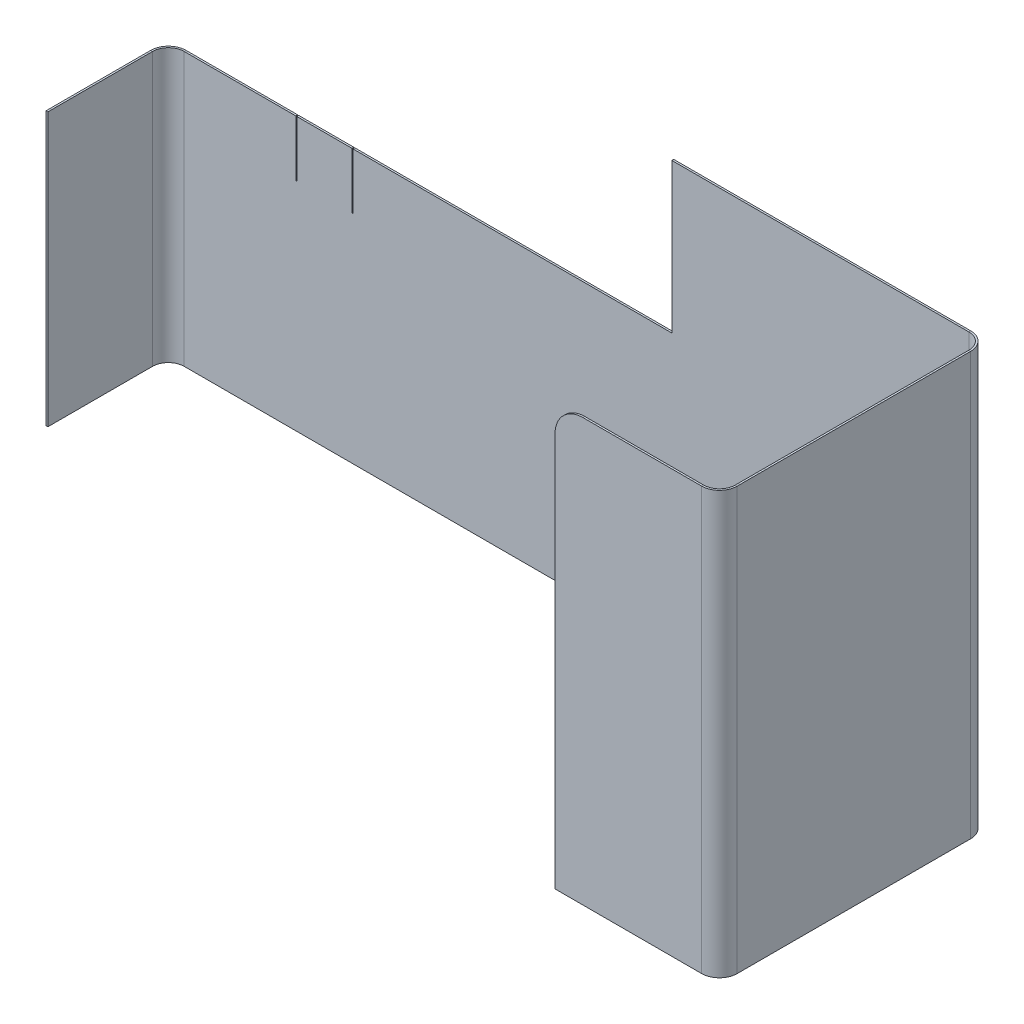
from build123d import *

# Parameters (mm, degrees)
T_LE_DE_BASE_PLI_E1_DEPTH = 226
CONG_1_R                  = 15
ESQUISSE2_W               = 270.5
ESQUISSE2_H               = 65.5
ENL_V_MAT_EXTRU_1_DEPTH   = 80
ESQUISSE6_W               = 0.5
ESQUISSE6_H               = 30
ENL_V_MAT_EXTRU_2_DEPTH   = 10


# Read off the part's stored shape, not the designer's step: Tôle de base pliée1
with BuildPart() as part:
    # Tôle de base pliée1 outline → Tôle de base pliée1 (new body)
    with BuildSketch(Plane(origin=(0, 0, 0), x_dir=(1, 0, 0), z_dir=(0, 1, 0))):
        with BuildLine():
            Line((-219.5, 85), (-219.5, 29))
            Line((-219.5, 29), (-218.5, 29))
            Line((-218.5, 29), (-218.5, 85))
            ThreePointArc((-218.5, 85), (-216.01040764, 91.01040764), (-210, 93.5))
            Line((-210, 93.5), (210, 93.5))
            ThreePointArc((210, 93.5), (216.01040764, 91.01040764), (218.5, 85))
            Line((218.5, 85), (218.5, -40))
            ThreePointArc((218.5, -40), (216.01040764, -46.01040764), (210, -48.5))
            Line((210, -48.5), (131.5, -48.5))
            Line((131.5, -48.5), (131.5, -49.5))
            Line((131.5, -49.5), (210, -49.5))
            ThreePointArc((210, -49.5), (216.717514421, -46.717514421), (219.5, -40))
            Line((219.5, -40), (219.5, 85))
            ThreePointArc((219.5, 85), (216.717514421, 91.717514421), (210, 94.5))
            Line((210, 94.5), (-210, 94.5))
            ThreePointArc((-210, 94.5), (-216.717514421, 91.717514421), (-219.5, 85))
        make_face()
    extrude(amount=T_LE_DE_BASE_PLI_E1_DEPTH)

    # Congé1
    cong_1_edges = [part.edges().sort_by_distance(p)[0] for p in [
        (131.5, 226, 49),
    ]]
    fillet(cong_1_edges, radius=CONG_1_R)

    # Esquisse2 → Enlèv. mat.-Extru.1 (cut)
    with BuildSketch(Plane(origin=(0, 226, 0), x_dir=(1, 0, 0), z_dir=(0, 1, 0))):
        with Locations((-84.25, 61.75)):
            Rectangle(ESQUISSE2_W, ESQUISSE2_H)
    extrude(amount=-ENL_V_MAT_EXTRU_1_DEPTH, mode=Mode.SUBTRACT)

    # Esquisse6 → Enlèv. mat.-Extru.2 (cut)
    with BuildSketch(Plane(origin=(0, 0, -94.5), x_dir=(-1, 0, 0), z_dir=(0, 0, -1))):
        with Locations((120, 131)):
            Rectangle(ESQUISSE6_W, ESQUISSE6_H)
        with Locations((150, 131)):
            Rectangle(ESQUISSE6_W, ESQUISSE6_H)
    extrude(amount=-ENL_V_MAT_EXTRU_2_DEPTH, mode=Mode.SUBTRACT)


solid = part.part
